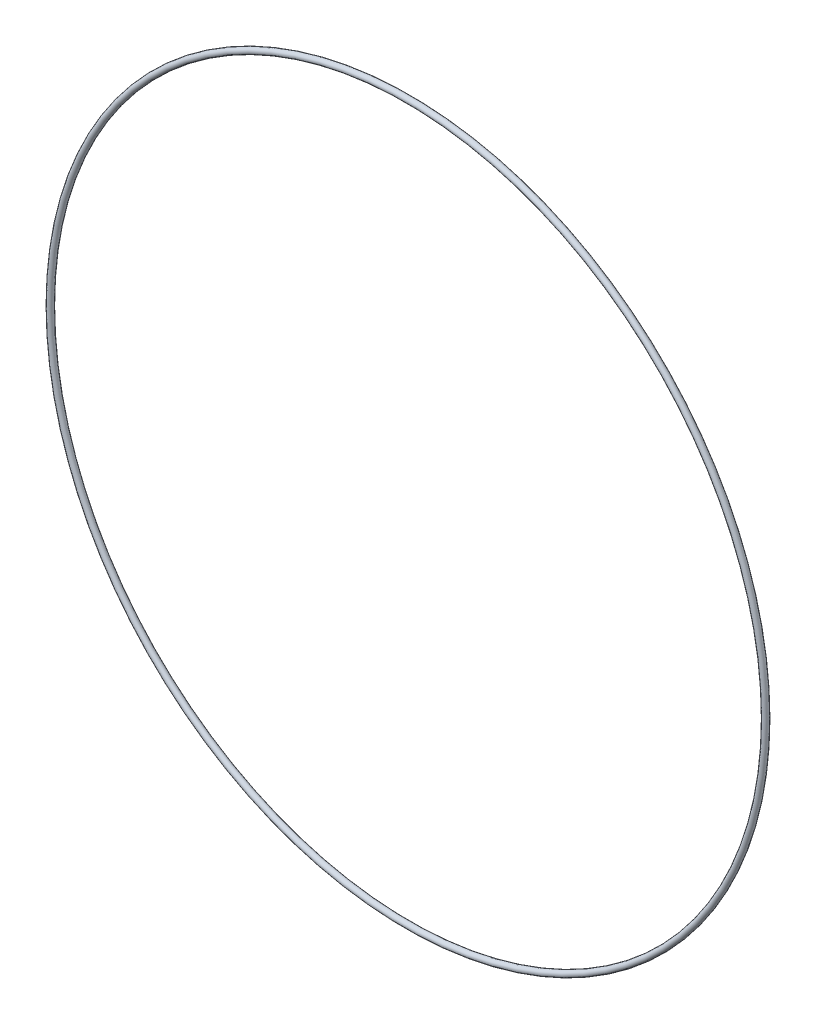
from build123d import *

# Parameters (mm, degrees)
SKETCH3_R = 1


with BuildPart() as part:
    # Sketch3 → Revolve1 (revolve)
    with BuildSketch(Plane(origin=(0, 0, 0), x_dir=(0, 0, -1), z_dir=(1, 0, 0))):
        with Locations((0, 118)):
            Circle(SKETCH3_R)
    revolve(axis=Axis((0, 0, 0), (0, 0, -1)))


solid = part.part
